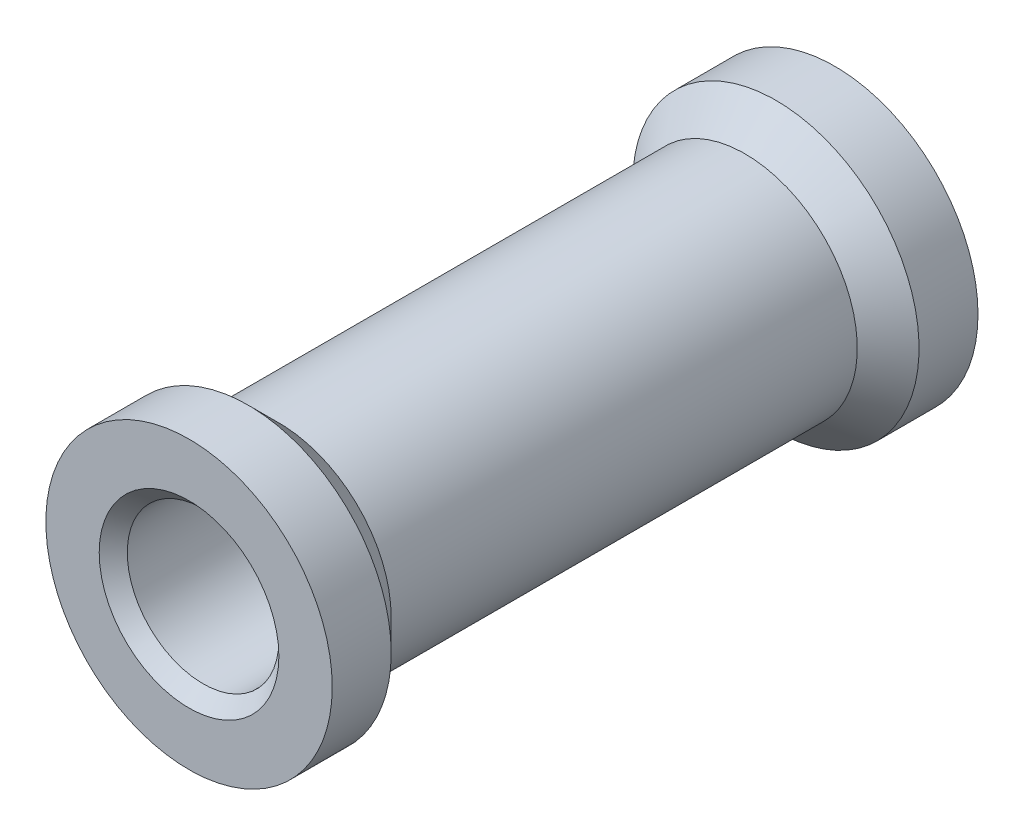
from build123d import *

# Parameters (mm, degrees)
SKETCH2_R           = 5.1
SKETCH2_R_2         = 2.7
BOSS_EXTRUDE1_DEPTH = 2
SKETCH3_R           = 4
SKETCH3_R_2         = 2.7
BOSS_EXTRUDE2_DEPTH = 19
SKETCH4_R           = 5.1
SKETCH4_R_2         = 2.7
BOSS_EXTRUDE3_DEPTH = 2
CHAMFER1_SIZE       = 1.2
CHAMFER2_SIZE       = 0.5


with BuildPart() as part:
    # Sketch2 → Boss-Extrude1 (new body)
    with BuildSketch(Plane.XY):
        Circle(SKETCH2_R)
        Circle(SKETCH2_R_2, mode=Mode.SUBTRACT)
    extrude(amount=BOSS_EXTRUDE1_DEPTH)

    # Sketch3 → Boss-Extrude2 (add)
    with BuildSketch(Plane.XY.offset(2)):
        Circle(SKETCH3_R)
        Circle(SKETCH3_R_2, mode=Mode.SUBTRACT)
    extrude(amount=BOSS_EXTRUDE2_DEPTH)

    # Sketch4 → Boss-Extrude3 (add)
    with BuildSketch(Plane.XY.offset(21)):
        Circle(SKETCH4_R)
        Circle(SKETCH4_R_2, mode=Mode.SUBTRACT)
    extrude(amount=BOSS_EXTRUDE3_DEPTH)

    # Chamfer1
    # the kernel refuses this chamfer: 1.2 mm, written as the material it adds along each edge
    with BuildSketch(Plane(origin=(0, 0, 21), x_dir=(1, 0, 0), z_dir=(0, -1, 0))) as chamfer1_piece_1_section:
        Polygon((4, -CHAMFER1_SIZE), (4 + CHAMFER1_SIZE, 0), (4, 0), align=None)
    chamfer1_piece_1 = revolve(axis=Axis((0, 0, 21), (0, 0, 1)), mode=Mode.PRIVATE)
    chamfer1_piece_1 = chamfer1_piece_1 & Plane(origin=(0, 0, 20.352695211), x_dir=(1, 0, 0), z_dir=(0, 0, -1)) * Cylinder(5.1, 21, mode=Mode.PRIVATE)
    add(chamfer1_piece_1)
    with BuildSketch(Plane(origin=(0, 0, 2), x_dir=(1, 0, 0), z_dir=(0, -1, 0))) as chamfer1_piece_2_section:
        Polygon((4 + CHAMFER1_SIZE, 0), (4, CHAMFER1_SIZE), (4, 0), align=None)
    chamfer1_piece_2 = revolve(axis=Axis((0, 0, 2), (0, 0, 1)), mode=Mode.PRIVATE)
    chamfer1_piece_2 = chamfer1_piece_2 & Plane(origin=(0, 0, 2.647304789), x_dir=(1, 0, 0), z_dir=(0, 0, -1)) * Cylinder(5.1, 21, mode=Mode.PRIVATE)
    add(chamfer1_piece_2)

    # Chamfer2
    chamfer2_edges = [part.edges().sort_by_distance(p)[0] for p in [
        (-2.7, 0, 23),
        (-2.7, 0, 0),
    ]]
    chamfer(chamfer2_edges, length=CHAMFER2_SIZE)


solid = part.part
